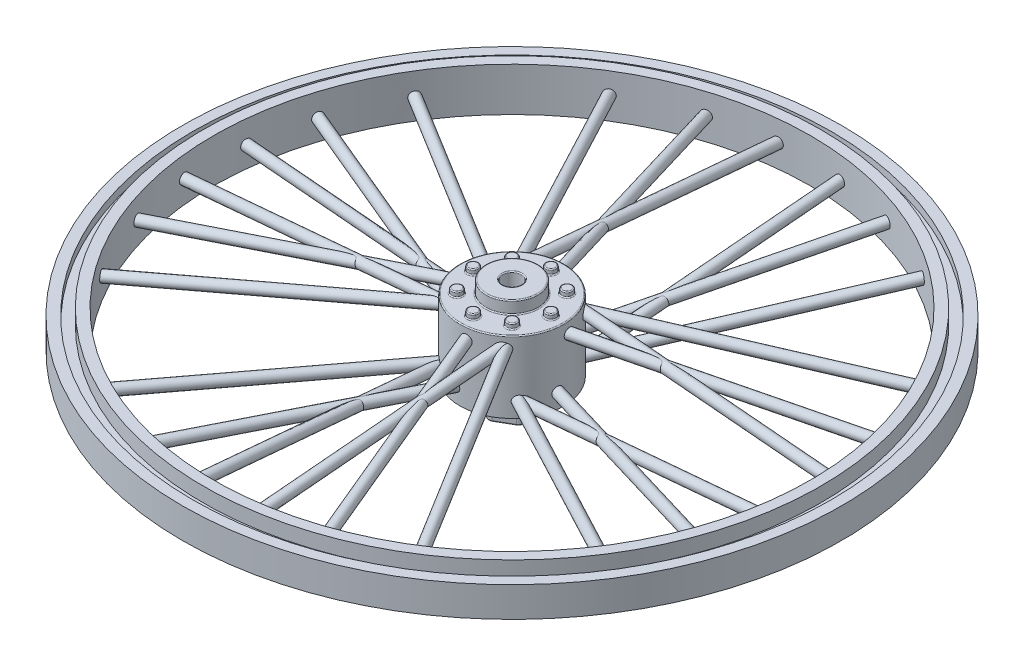
from build123d import *

# Parameters (mm, degrees)
BOSS_EXTRUDE1_START      = -3.6
SKETCH2_R                = 5
BOSS_EXTRUDE1_DEPTH      = 6.9
SWEEP1_PROFILE_R         = 0.5
SWEEP2_PROFILE_R         = 0.5
SWEEP3_PROFILE_R         = 0.5
SWEEP4_PROFILE_R         = 0.5
SWEEP5_PROFILE_R         = 0.5
SWEEP6_PROFILE_R         = 0.5
CIRPATTERN1_COUNT        = 4
CUT_EXTRUDE1_DEPTH       = 5
BOSS_EXTRUDE2_DEPTH      = 7.6
SKETCH11_R               = 2.5
BOSS_EXTRUDE3_DEPTH      = 1.2
SKETCH12_R               = 0.9
CUT_EXTRUDE2_DEPTH       = 47.158585334
SKETCH13_R               = 0.5
BOSS_EXTRUDE4_DEPTH      = 0.5
FILLET2_R                = 0.1
FILLET3_R                = 0.1
CIRPATTERN3_COUNT        = 8
FILLET3_OF_CIRPATTERN3_R = 0.1
FILLET4_R                = 0.5


with BuildPart() as part:
    # Sketch1 → Revolve2 (revolve)
    with BuildSketch(Plane(origin=(0, 0, 0), x_dir=(0, 0, -1), z_dir=(1, 0, 0))):
        Polygon((30.75, 1.45), (31.75, 1.45), (31.75, -1.45), (30.75, -1.45), (30.75, -0.7), (29.75, -0.7), (29.75, -2.1), (28.75, -2.1), (28.75, 2.1), (29.75, 2.1), (29.75, 0.7), (30.75, 0.7), align=None)
    revolve(axis=Axis((0, 0, 0), (0, 1, 0)))



with BuildPart() as body_2:
    # Sketch2 → Boss-Extrude1 (new body)
    with BuildSketch(Plane(origin=(0, 0, 0), x_dir=(1, 0, 0), z_dir=(0, 1, 0)).offset(BOSS_EXTRUDE1_START)):
        with Locations(Location((0, 0, 0), (0, 0, 90))):
            Circle(SKETCH2_R)
    extrude(amount=BOSS_EXTRUDE1_DEPTH)


with BuildPart() as part_1:
    add(part.part)

    add(body_2.part)  # Sweep1 merges body 2
    # Sweep1: sweep along a path in Sketch3
    with BuildLine(Plane(origin=(3, 0, 0), x_dir=(0, 0, -1), z_dir=(1, 0, 0))) as sweep1_path:
        Line((-29.598352995, 0), (0, 2.589520346))
    # Sweep1 profile (on start of the path) → Sweep1 (sweep)
    with BuildSketch(Plane(origin=(3, 0, 29.598352995), x_dir=(0, -0.9961946980917455, -0.08715574274765832), z_dir=(0, 0.08715574274765832, -0.9961946980917455))):
        Circle(SWEEP1_PROFILE_R)
    sweep1 = sweep(path=sweep1_path.line)

    # Sweep2: sweep along a path in Sketch4
    with BuildLine(Plane(origin=(-1.109703818, 0, 0.403899159), x_dir=(0.3420201433256631, 0, 0.9396926207859105), z_dir=(-0.9396926207859104, 0, 0.34202014332566305))) as sweep2_path:
        Line((29.726552489, 0), (0, 2.600736349))
    # Sweep2 profile (on start of the path) → Sweep2 (sweep)
    with BuildSketch(Plane(origin=(9.057375925, 0, 28.337721174), x_dir=(-0.9396926207859104, 0, 0.3420201433256631), z_dir=(-0.3407186534216045, 0.08715574274765824, -0.9361168066628612))):
        Circle(SWEEP2_PROFILE_R)
    sweep2 = sweep(path=sweep2_path.line)

    # Sweep3: sweep along a path in Sketch5
    with BuildLine(Plane(origin=(0.734455543, 0, -0.424038106), x_dir=(-0.500000000000001, 0, -0.866025403784438), z_dir=(0.866025403784438, 0, -0.500000000000001))) as sweep3_path:
        Line((-29.737909589, 0), (0, 2.601729966))
    # Sweep3 profile (on start of the path) → Sweep3 (sweep)
    with BuildSketch(Plane(origin=(15.603410338, 0, 25.329747054), x_dir=(-0.866025403784438, 0, 0.500000000000001), z_dir=(-0.49809734904587377, 0.08715574274765832, -0.8627299156628203))):
        Circle(SWEEP3_PROFILE_R)
    sweep3 = sweep(path=sweep3_path.line)

    # Sweep4: sweep along a path in Sketch6
    with BuildLine(Plane(origin=(3, 0, 0), x_dir=(0, 0, -1), z_dir=(1, 0, 0))) as sweep4_path:
        Line((0, -2.589520346), (29.598352995, 0))
    # Sweep4 profile (on start of the path) → Sweep4 (sweep)
    with BuildSketch(Plane(origin=(3, -2.589520346, 0), x_dir=(0, -0.9961946980917462, -0.0871557427476517), z_dir=(0, 0.0871557427476517, -0.9961946980917462))):
        Circle(SWEEP4_PROFILE_R)
    sweep4 = sweep(path=sweep4_path.line)

    # Sweep5: sweep along a path in Sketch7
    with BuildLine(Plane(origin=(-1.109703818, 0, -0.403899159), x_dir=(0.34202014332566943, 0, -0.9396926207859081), z_dir=(0.9396926207859081, 0, 0.34202014332566943))) as sweep5_path:
        Line((29.726552489, 0), (0, -2.600736349))
    # Sweep5 profile (on start of the path) → Sweep5 (sweep)
    with BuildSketch(Plane(origin=(9.057375925, 0, -28.337721174), x_dir=(0.9396926207859082, 0, 0.34202014332566943), z_dir=(-0.340718653421611, -0.08715574274765156, 0.9361168066628595))):
        Circle(SWEEP5_PROFILE_R)
    sweep5 = sweep(path=sweep5_path.line)

    # Sweep6: sweep along a path in Sketch8
    with BuildLine(Plane(origin=(0.734455543, 0, 0.424038106), x_dir=(-0.49999999999999495, 0, 0.8660254037844416), z_dir=(-0.8660254037844416, 0, -0.49999999999999495))) as sweep6_path:
        Line((-29.737909589, 0), (0, -2.601729966))
    # Sweep6 profile (on start of the path) → Sweep6 (sweep)
    with BuildSketch(Plane(origin=(15.603410338, 0, -25.329747054), x_dir=(0.8660254037844416, 0, 0.4999999999999949), z_dir=(-0.498097349045868, -0.08715574274765119, 0.8627299156628243))):
        Circle(SWEEP6_PROFILE_R)
    sweep6 = sweep(path=sweep6_path.line)

    # CirPattern1: Sweep1, Sweep2, Sweep3, Sweep4, Sweep5, Sweep6 ×4 about axis
    cirpattern1_axis = Axis((0, 3.3, 0), (0, 1, 0))
    add([sweep1.rotate(cirpattern1_axis, i * 360 / CIRPATTERN1_COUNT) for i in range(1, CIRPATTERN1_COUNT)])
    add([sweep2.rotate(cirpattern1_axis, i * 360 / CIRPATTERN1_COUNT) for i in range(1, CIRPATTERN1_COUNT)])
    add([sweep3.rotate(cirpattern1_axis, i * 360 / CIRPATTERN1_COUNT) for i in range(1, CIRPATTERN1_COUNT)])
    add([sweep4.rotate(cirpattern1_axis, i * 360 / CIRPATTERN1_COUNT) for i in range(1, CIRPATTERN1_COUNT)])
    add([sweep5.rotate(cirpattern1_axis, i * 360 / CIRPATTERN1_COUNT) for i in range(1, CIRPATTERN1_COUNT)])
    add([sweep6.rotate(cirpattern1_axis, i * 360 / CIRPATTERN1_COUNT) for i in range(1, CIRPATTERN1_COUNT)])

    # Sketch9 → Cut-Extrude1 (cut)
    with BuildSketch(Plane.XZ.offset(3.6)):
        with BuildLine():
            Line((-3.929058411, 0.75), (-2, 0.75))
            Line((-2, 0.75), (-2, -0.75))
            Line((-2, -0.75), (-3.929058411, -0.75))
            ThreePointArc((-3.929058411, -0.75), (0, -4), (3.929058411, -0.75))
            Line((3.929058411, -0.75), (2, -0.75))
            Line((2, -0.75), (2, 0.75))
            Line((2, 0.75), (3.929058411, 0.75))
            ThreePointArc((3.929058411, 0.75), (0, 4), (-3.929058411, 0.75))
        make_face()
    extrude(amount=-CUT_EXTRUDE1_DEPTH, mode=Mode.SUBTRACT)

    # Sketch10 → Boss-Extrude2 (add)
    with BuildSketch(Plane.XZ.offset(-1.4)):
        Polygon((-2, 1.154700538), (-2, -1.154700538), (0, -2.309401077), (2, -1.154700538), (2, 1.154700538), (0, 2.309401077), align=None)
    extrude(amount=BOSS_EXTRUDE2_DEPTH)

    # Sketch11 → Boss-Extrude3 (add)
    with BuildSketch(Plane(origin=(0, 3.3, 0), x_dir=(1, 0, 0), z_dir=(0, 1, 0))):
        with Locations(Location((0, 0, 0), (0, 0, 270))):
            Circle(SKETCH11_R)
    extrude(amount=BOSS_EXTRUDE3_DEPTH)

    # Sketch12 → Cut-Extrude2 (cut, through all)
    with BuildSketch(Plane(origin=(0, 4.5, 0), x_dir=(1, 0, 0), z_dir=(0, 1, 0))):
        with Locations(Location((0, 0, 0), (0, 0, 270))):
            Circle(SKETCH12_R)
    extrude(amount=-CUT_EXTRUDE2_DEPTH, mode=Mode.SUBTRACT)

    # Sketch13 → Boss-Extrude4 (add)
    with BuildSketch(Plane(origin=(0, 3.3, 0), x_dir=(1, 0, 0), z_dir=(0, 1, 0))):
        with Locations(Location((-3.75, 0, 0), (0, 0, 270))):
            Circle(SKETCH13_R)
    boss_extrude4 = extrude(amount=BOSS_EXTRUDE4_DEPTH)

    # Fillet2
    fillet2_edges = [part_1.edges().sort_by_distance(p)[0] for p in [
        (2, -6.2, 0),
        (-2, -6.2, 0),
        (1, -6.2, 1.732050808),
        (1, -6.2, -1.732050808),
        (-1, -6.2, -1.732050808),
        (-1, -6.2, 1.732050808),
        (0, 3.3, -2.5),
        (0, 4.5, -2.5),
        (0, -6.2, -0.9),
        (0, 4.5, -0.9),
        (0, 3.3, 5),
    ]]
    fillet(fillet2_edges, radius=FILLET2_R)

    # Fillet3
    fillet3_edges = [part_1.edges().sort_by_distance(p)[0] for p in [
        (-3.75, 3.3, -0.5),
        (-3.75, 3.8, -0.5),
    ]]
    fillet(fillet3_edges, radius=FILLET3_R)

    # CirPattern3: Boss-Extrude4 ×8 about axis
    cirpattern3_axis = Axis((0, 0, 0), (0, 1, 0))
    for i in range(1, CIRPATTERN3_COUNT):
        add(boss_extrude4.rotate(cirpattern3_axis, i * 360 / CIRPATTERN3_COUNT))

    # Fillet3 of CirPattern3
    fillet3_of_cirpattern3_edges = [part_1.edges().sort_by_distance(p)[0] for p in [
        (-3.00520382, 3.3, 2.298097039),
        (-3.00520382, 3.8, 2.298097039),
        (-0.5, 3.3, 3.75),
        (-0.5, 3.8, 3.75),
        (2.298097039, 3.3, 3.00520382),
        (2.298097039, 3.8, 3.00520382),
        (3.75, 3.3, 0.5),
        (3.75, 3.8, 0.5),
        (3.00520382, 3.3, -2.298097039),
        (3.00520382, 3.8, -2.298097039),
        (0.5, 3.3, -3.75),
        (0.5, 3.8, -3.75),
        (-2.298097039, 3.3, -3.00520382),
        (-2.298097039, 3.8, -3.00520382),
    ]]
    fillet(fillet3_of_cirpattern3_edges, radius=FILLET3_OF_CIRPATTERN3_R)

    # Fillet4
    # the kernel refuses this fillet: 0.5 mm, written as the material it takes off along each edge
    with BuildSketch(Plane(origin=(0, -6.2, -1.732050808), x_dir=(-0.5000000000000001, 0, -0.8660254037844386), z_dir=(-0.8660254037844386, 0, 0.5000000000000001))) as fillet4_piece_1:
        with BuildLine():
            CenterArc((0.4, -0.1), 0.1, 0, 90)
            Line((0.5, -0.1), (0.5, 0))
            Line((0.5, 0), (0.4, 0))
        make_face()
    revolve(axis=Axis((0, -6.2, -1.732050808), (0, -1, 0)), revolution_arc=60, mode=Mode.SUBTRACT)
    with BuildSketch(Plane(origin=(1.5, -6.2, -0.866025404), x_dir=(0.5000000000000003, 0, -0.8660254037844385), z_dir=(-0.8660254037844385, 0, -0.5000000000000003))) as fillet4_piece_2:
        with BuildLine():
            CenterArc((0.4, -0.1), 0.1, 0, 90)
            Line((0.5, -0.1), (0.5, 0))
            Line((0.5, 0), (0.4, 0))
        make_face()
    revolve(axis=Axis((1.5, -6.2, -0.866025404), (0, -1, 0)), revolution_arc=60, mode=Mode.SUBTRACT)
    with BuildSketch(Plane(origin=(-1.5, -6.2, -0.866025404), x_dir=(-1, 0, 0), z_dir=(0, 0, 1))) as fillet4_piece_3:
        with BuildLine():
            CenterArc((0.4, -0.1), 0.1, 0, 90)
            Line((0.5, -0.1), (0.5, 0))
            Line((0.5, 0), (0.4, 0))
        make_face()
    revolve(axis=Axis((-1.5, -6.2, -0.866025404), (0, -1, 0)), revolution_arc=60, mode=Mode.SUBTRACT)
    with BuildSketch(Plane(origin=(1.5, -6.2, 0.866025404), x_dir=(1, 0, 0), z_dir=(0, 0, -1))) as fillet4_piece_4:
        with BuildLine():
            CenterArc((0.4, -0.1), 0.1, 0, 90)
            Line((0.5, -0.1), (0.5, 0))
            Line((0.5, 0), (0.4, 0))
        make_face()
    revolve(axis=Axis((1.5, -6.2, 0.866025404), (0, -1, 0)), revolution_arc=60, mode=Mode.SUBTRACT)
    with BuildSketch(Plane(origin=(-1.5, -6.2, 0.866025404), x_dir=(-0.5000000000000001, 0, 0.8660254037844387), z_dir=(0.8660254037844387, 0, 0.5000000000000001))) as fillet4_piece_5:
        with BuildLine():
            CenterArc((0.4, -0.1), 0.1, 0, 90)
            Line((0.5, -0.1), (0.5, 0))
            Line((0.5, 0), (0.4, 0))
        make_face()
    revolve(axis=Axis((-1.5, -6.2, 0.866025404), (0, -1, 0)), revolution_arc=60, mode=Mode.SUBTRACT)
    with BuildSketch(Plane(origin=(0, -6.2, 1.732050808), x_dir=(0.5000000000000001, 0, 0.8660254037844387), z_dir=(0.8660254037844387, 0, -0.5000000000000001))) as fillet4_piece_6:
        with BuildLine():
            CenterArc((0.4, -0.1), 0.1, 0, 90)
            Line((0.5, -0.1), (0.5, 0))
            Line((0.5, 0), (0.4, 0))
        make_face()
    revolve(axis=Axis((0, -6.2, 1.732050808), (0, -1, 0)), revolution_arc=60, mode=Mode.SUBTRACT)
    with BuildSketch(Plane(origin=(-2, 1.4, 1.154700538), x_dir=(0, 0, -1), z_dir=(0, -1, 0)), Plane(origin=(2, 1.4, -1.154700538), x_dir=(0, 0, 1), z_dir=(0, -1, 0)), Plane(origin=(0, 1.4, -2.309401077), x_dir=(0.8660254037844386, 0, 0.5), z_dir=(0, -1, 0))) as fillet4_piece_7:
        with BuildLine():
            CenterArc((FILLET4_R * 0.57735026919, FILLET4_R), FILLET4_R, 210, 60)
            Line((-FILLET4_R * 0.288675134595, FILLET4_R * 0.5), (0, 0))
            Line((0, 0), (FILLET4_R * 0.57735026919, 0))
        make_face()
    extrude(amount=7.6, mode=Mode.SUBTRACT)
    with BuildSketch(Plane(origin=(0, 1.4, 2.309401077), x_dir=(0.8660254037844392, 0, -0.4999999999999992), z_dir=(0, -1, 0)), Plane(origin=(2, 1.4, 1.154700538), x_dir=(0, 0, -1), z_dir=(0, -1, 0)), Plane(origin=(-2, 1.4, -1.154700538), x_dir=(0, 0, 1), z_dir=(0, -1, 0))) as fillet4_piece_8:
        with BuildLine():
            CenterArc((FILLET4_R * 0.57735026919, -FILLET4_R), FILLET4_R, 90, 60)
            Line((-FILLET4_R * 0.288675134595, -FILLET4_R * 0.5), (0, 0))
            Line((0, 0), (FILLET4_R * 0.57735026919, 0))
        make_face()
    extrude(amount=7.6, mode=Mode.SUBTRACT)


solid = part_1.part
